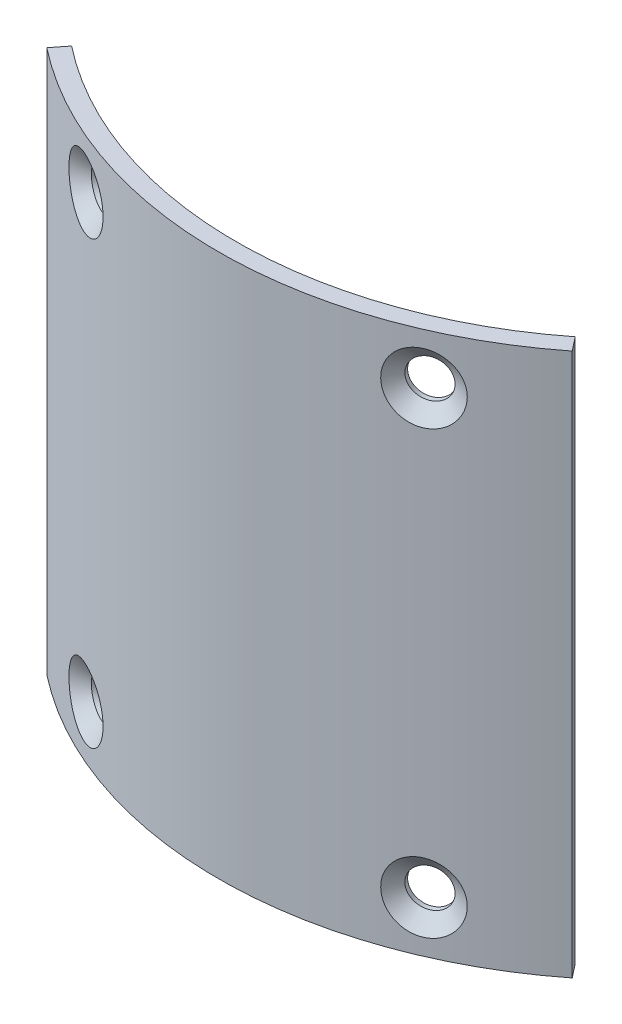
from build123d import *

# Parameters (mm, degrees)
SKETCH1_R           = 76.2
SKETCH1_R_2         = 74.549
BOSS_EXTRUDE1_DEPTH = 254
WRAP2_SECTION_W     = 3.302
WRAP2_SECTION_H     = 101.6
WRAP2_ANGLE         = 76.394372684
SKETCH4_W           = 76.2
SKETCH4_H           = 254


# Read off the part's stored shape, not the designer's step: CSK for 1/4 Flat Head Machine Screw (100)1
with BuildPart() as part:
    # Sketch1 → Boss-Extrude1 (new body)
    with BuildSketch(Plane(origin=(0, 0, 0), x_dir=(1, 0, 0), z_dir=(0, 1, 0))):
        with Locations(Location((0, 0, 0), (0, 0, 270))):
            Circle(SKETCH1_R)
        with Locations(Location((0, 0, 0), (0, 0, 270))):
            Circle(SKETCH1_R_2, mode=Mode.SUBTRACT)
    extrude(amount=BOSS_EXTRUDE1_DEPTH)

    # Wrap2 section (on wrap section) → Wrap2 (revolve)
    with BuildSketch(Plane(origin=(0, 0, 0), x_dir=(0.6183698030697371, 0, 0.7858872607769479), z_dir=(0.7858872607769479, 0, -0.6183698030697371))):
        with Locations((77.851, -127)):
            Rectangle(WRAP2_SECTION_W, WRAP2_SECTION_H)
    revolve(axis=Axis((0, 0, 0), (0, -1, 0)), revolution_arc=WRAP2_ANGLE)

    # Sketch4 → Cut-Revolve1 (revolve, cut)
    with BuildSketch(Plane(origin=(0, 0, 0), x_dir=(0, 0, -1), z_dir=(1, 0, 0))):
        with Locations((38.1, 127)):
            Rectangle(SKETCH4_W, SKETCH4_H)
    revolve(axis=Axis((0, 254, 0), (0, -1, 0)), mode=Mode.SUBTRACT)

    # CSK for 1_4 Flat Head Machine Screw  2 → CSK for 1/4 Flat Head Machine Screw (100)1 (revolve, cut)
    with BuildSketch(Plane(origin=(0, 85.725, 0), x_dir=(0.916971382275524, 0, 0.39895298480863006), z_dir=(0, 1, 0))):
        Polygon((0, -79.50211718), (6.43903965, -79.50211718), (3.57124, -77.095747552), (3.57124, -76.116222895), (0, -76.116222895), align=None)
    revolve(axis=Axis((0, 85.725, 0), (0.3989529848086302, 0, -0.9169713822755242)), mode=Mode.SUBTRACT)

    # CSK for 1_4 Flat Head Machine Screw 3 ou → CSK for 1_4 Flat Head Machine Screw  3 (revolve, cut)
    with BuildSketch(Plane(origin=(0, 85.725, 0), x_dir=(0.9169713822755243, 0, -0.3989529848086292), z_dir=(0, -1, 0))):
        Polygon((6.439064088, 79.502137686), (0, 79.502137686), (0, 76.116222895), (3.57124, 76.116222895), (3.57124, 77.095747552), align=None)
    revolve(axis=Axis((0, 85.725, 0), (0.3989529848086292, 0, 0.9169713822755243)), mode=Mode.SUBTRACT)

    # CSK for 1_4 Flat Head Machine Screw 4 ou → CSK for 1_4 Flat Head Machine Screw  4 (revolve, cut)
    with BuildSketch(Plane(origin=(0, 168.275, 0), x_dir=(0.9169713822755243, 0, -0.3989529848086292), z_dir=(0, -1, 0))):
        Polygon((6.439064088, 79.502137686), (0, 79.502137686), (0, 76.116222895), (3.57124, 76.116222895), (3.57124, 77.095747552), align=None)
    revolve(axis=Axis((0, 168.275, 0), (0.3989529848086292, 0, 0.9169713822755243)), mode=Mode.SUBTRACT)

    # CSK for 1_4 Flat Head Machine Screw 5 ou → CSK for 1_4 Flat Head Machine Screw  5 (revolve, cut)
    with BuildSketch(Plane(origin=(0, 168.275, 0), x_dir=(0.916971382275524, 0, 0.39895298480863006), z_dir=(0, 1, 0))):
        Polygon((0, -79.50211718), (6.43903965, -79.50211718), (3.57124, -77.095747552), (3.57124, -76.116222895), (0, -76.116222895), align=None)
    revolve(axis=Axis((0, 168.275, 0), (0.3989529848086302, 0, -0.9169713822755242)), mode=Mode.SUBTRACT)


solid = part.part
